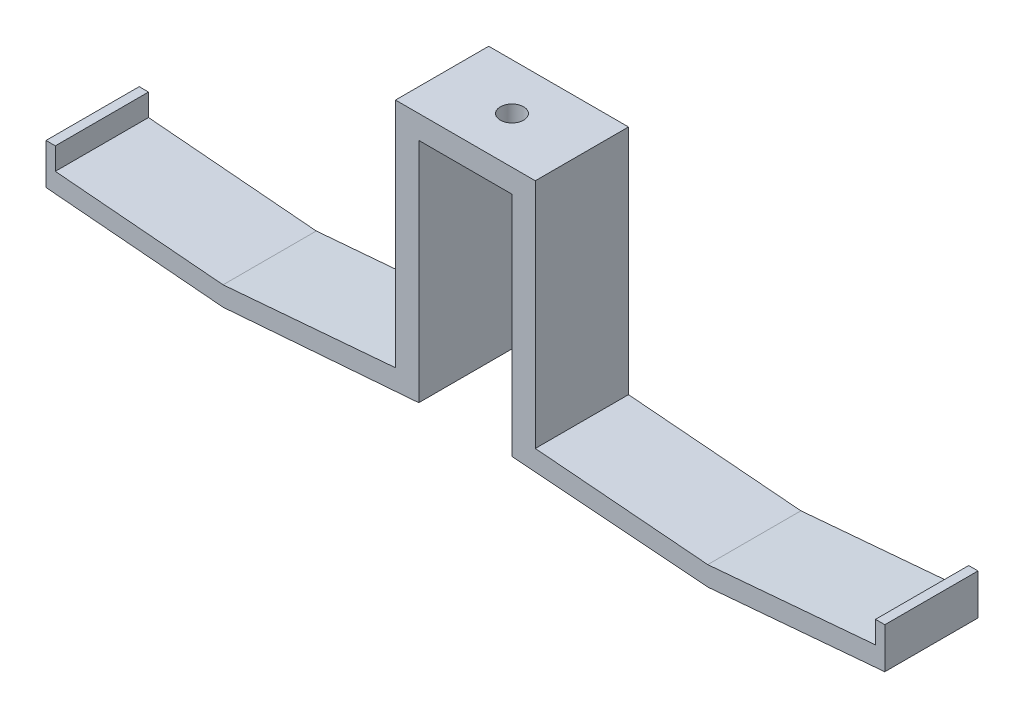
from build123d import *

# Parameters (mm, degrees)
BOSS_EXTRUDE1_DEPTH = 25.4
CUT_EXTRUDE1_REACH  = 139.665
SKETCH3_R           = 3.175


with BuildPart() as part:
    # Sketch2 → Boss-Extrude1 (new body)
    with BuildSketch(Plane.XY):
        Polygon((12.7, 0), (12.7, -61.9179737), (66.04, -66.051353419), (114.3, -61.9179737), (114.3, -50.811353419), (111.76, -50.811353419), (111.76, -56.8379737), (66.04, -60.753807118), (19.05, -56.8379737), (19.05, 6.35), (-19.05, 6.35), (-19.05, -56.8379737), (-66.04, -60.753807118), (-111.76, -56.8379737), (-111.76, -50.811353419), (-114.3, -50.811353419), (-114.3, -61.9179737), (-66.04, -66.051353419), (-12.7, -61.9179737), (-12.7, 0), align=None)
    extrude(amount=BOSS_EXTRUDE1_DEPTH)

    # Sketch3 → Cut-Extrude1 (cut, up to next)
    with BuildSketch(Plane(origin=(0, 6.35, 0), x_dir=(1, 0, 0), z_dir=(0, 1, 0)), mode=Mode.PRIVATE) as cut_extrude1_sk1:
        with Locations((0, -12.7)):
            Circle(SKETCH3_R)
    cut_extrude1_tool1 = extrude(cut_extrude1_sk1.sketch, amount=-CUT_EXTRUDE1_REACH, mode=Mode.PRIVATE) & part.part
    add(cut_extrude1_tool1.solids().sort_by_distance((0, 6.35, 12.7))[0], mode=Mode.SUBTRACT)


solid = part.part
